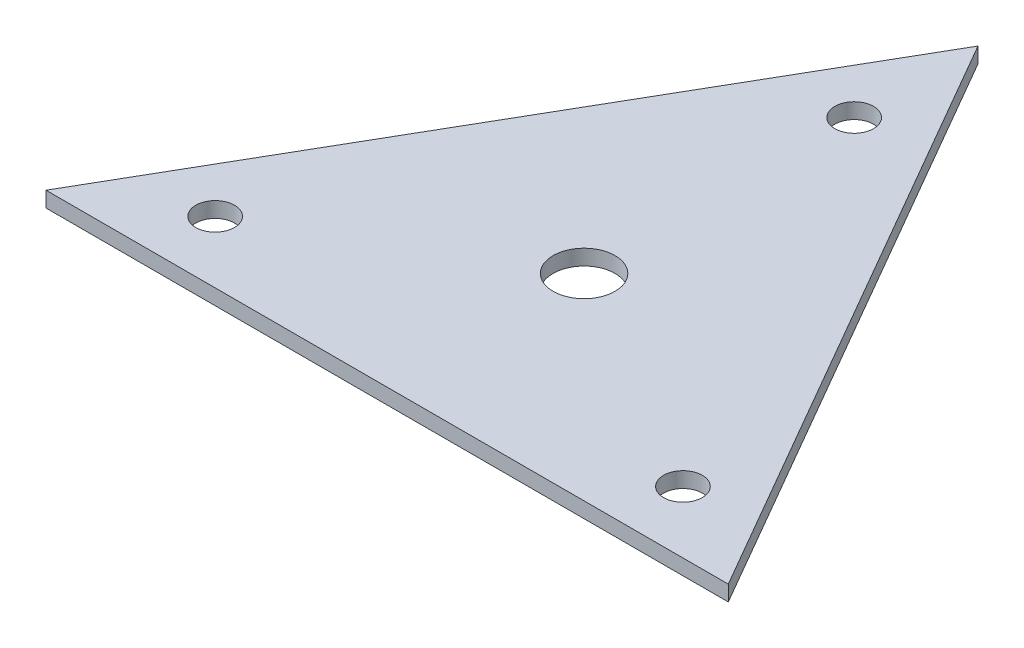
from build123d import *

# Parameters (mm, degrees)
SKETCH1_R           = 6.35
SKETCH1_R_2         = 3.96875
BOSS_EXTRUDE1_DEPTH = 3.175
SKETCH2_R           = 6.35
CUT_EXTRUDE1_DEPTH  = 0.254


with BuildPart() as part:
    # Sketch1 → Boss-Extrude1 (new body)
    with BuildSketch(Plane(origin=(0, 0, 0), x_dir=(1, 0, 0), z_dir=(0, 1, 0))):
        Polygon((0, 0), (139.954, 0), (69.977, 121.203719361), align=None)
        with Locations((69.977, 40.401239787)):
            Circle(SKETCH1_R, mode=Mode.SUBTRACT)
        with Locations((117.956954744, 12.7)):
            Circle(SKETCH1_R_2, mode=Mode.SUBTRACT)
        with Locations((21.997045256, 12.7)):
            Circle(SKETCH1_R_2, mode=Mode.SUBTRACT)
        with Locations((69.977, 95.803719361)):
            Circle(SKETCH1_R_2, mode=Mode.SUBTRACT)
    extrude(amount=BOSS_EXTRUDE1_DEPTH)

    # Sketch2 → Cut-Extrude1 (cut)
    with BuildSketch(Plane(origin=(0, 0, 0), x_dir=(1, 0, 0), z_dir=(0, 1, 0))):
        with Locations((93.966977372, 54.251859681)):
            Circle(SKETCH2_R)
        with Locations((69.977, 12.7)):
            Circle(SKETCH2_R)
        with Locations((45.987022628, 54.251859681)):
            Circle(SKETCH2_R)
    extrude(amount=CUT_EXTRUDE1_DEPTH, mode=Mode.SUBTRACT)


solid = part.part
